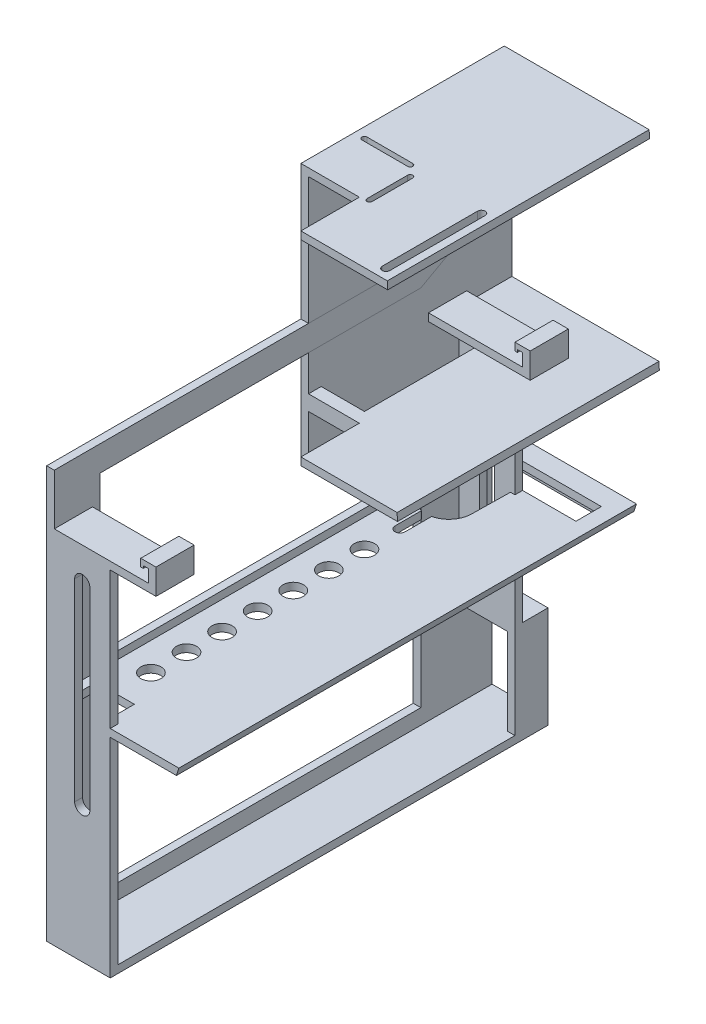
from build123d import *

# Parameters (mm, degrees)
EXTRUDE_1_DEPTH           = 103
EXTRUDE_2_DEPTH           = 180
SKETCH_4_W                = 23
SKETCH_4_H                = 23
CUT_EXTRUDE_5_DEPTH       = 80
SKETCH_1_4_W              = 24.5
SKETCH_1_4_H              = 20
SKETCH_1_4_W_2            = 18.5
SKETCH_1_4_H_2            = 14
EXTRUDE_3_DEPTH           = 80
SKETCH_5_W                = 17
SKETCH_5_H                = 60
CUT_EXTRUDE_6_DEPTH       = 23
CUT_EXTRUDE_7_DEPTH       = 23
CUT_EXTRUDE_8_DEPTH       = 23
SKETCH_8_W                = 25
SKETCH_8_H                = 85
EXTRUDE_4_DEPTH           = 5
SKETCH_9_W                = 0.952941176
SKETCH_9_H                = 3
CUT_EXTRUDE_9_DEPTH       = 200
EXTRUDE_5_DEPTH           = 7
CUT_EXTRUDE_12_DEPTH      = 234.122285507
CUT_EXTRUDE_12_DEPTH_BACK = 25
SKETCH_13_W               = 7.8
SKETCH_13_H               = 3
CUT_EXTRUDE_14_DEPTH      = 234.122285507
CUT_EXTRUDE_14_DEPTH_BACK = 3
SKETCH_13_5_W             = 7.8
SKETCH_13_5_H             = 79
SKETCH_15_W               = 25
SKETCH_15_H               = 40
SKETCH_15_W_2             = 19
SKETCH_15_H_2             = 34
EXTRUDE_6_DEPTH           = 10
SKETCH_16_W               = 22
SKETCH_16_H               = 100
EXTRUDE_7_DEPTH           = 3
SKETCH_20_W               = 43
SKETCH_20_H               = 10
CUT_EXTRUDE_15_DEPTH      = 3
SKETCH_24_W               = 3
SKETCH_24_H               = 52
EXTRUDE_8_DEPTH           = 3
SKETCH_25_W               = 25
SKETCH_25_H               = 137
EXTRUDE_9_DEPTH           = 3
SKETCH_28_W               = 15
SKETCH_28_H               = 10
CUT_EXTRUDE_16_DEPTH      = 3
SKETCH_29_W               = 1.908461085
SKETCH_29_H               = 79
CUT_EXTRUDE_17_DEPTH      = 22
CUT_EXTRUDE_18_DEPTH      = 10
CUT_EXTRUDE_19_DEPTH      = 10
SKETCH_30_W               = 15
SKETCH_30_H               = 10
CUT_EXTRUDE_20_DEPTH      = 10
SKETCH_31_W               = 3
SKETCH_31_H               = 34
EXTRUDE_10_DEPTH          = 3
SKETCH_32_W               = 156.2
SKETCH_32_H               = 52
EXTRUDE_11_DEPTH          = 3
EXTRUDE_14_DEPTH          = 5
SKETCH_36_W               = 3
SKETCH_36_H               = 162.2
EXTRUDE_15_DEPTH          = 20
SKETCH_37_W               = 29
SKETCH_37_H               = 162.2
EXTRUDE_16_DEPTH          = 3
SKETCH_37_3_W             = 3
SKETCH_37_3_H             = 162.2
EXTRUDE_17_DEPTH          = 3
CUT_EXTRUDE_START         = -3
CUT_EXTRUDE_23_OUTLINE_R  = 4
CUT_EXTRUDE_23_DEPTH      = 3
EXTRUDE_18_DEPTH          = 162.2
SKETCH_42_W               = 29
SKETCH_42_H               = 132.2
CUT_EXTRUDE_24_DEPTH      = 28
SKETCH_43_W               = 11
SKETCH_43_H               = 12
EXTRUDE_20_DEPTH          = 3
SKETCH_44_W               = 150.108461085
SKETCH_44_H               = 73
CUT_EXTRUDE_26_DEPTH      = 10
SKETCH_47_W               = 156.2
SKETCH_47_H               = 7
EXTRUDE_21_DEPTH          = 3
SKETCH_48_W               = 12
SKETCH_48_H               = 48
SKETCH_48_H_2             = 73
SKETCH_48_W_2             = 11.908461085
EXTRUDE_22_DEPTH          = 3
SKETCH_49_W               = 126.2
SKETCH_49_H               = 3
EXTRUDE_23_DEPTH          = 3


# Read off the part's stored shape, not the designer's step: 컷-돌출23
with BuildPart() as part:
    # 스케치1 → 보스-돌출1 (new body)
    with BuildSketch(Plane.XY):
        Polygon((0, 0), (61, 0), (60.85, 3), (3, 3), (3, 77), (57.15, 77), (57, 80), (0, 80), align=None)
    extrude(amount=EXTRUDE_1_DEPTH)

    # 스케치4 → 컷-돌출5 (cut)
    with BuildSketch(Plane(origin=(0, 80, 0), x_dir=(1, 0, 0), z_dir=(0, 1, 0))):
        with Locations((11.5, -91.5)):
            Rectangle(SKETCH_4_W, SKETCH_4_H)
    extrude(amount=-CUT_EXTRUDE_5_DEPTH, mode=Mode.SUBTRACT)

    # 스케치1<4> → 보스-돌출3 (add)
    with BuildSketch(Plane.XY):
        with Locations((12.25, -10)):
            Rectangle(SKETCH_1_4_W, SKETCH_1_4_H)
        with Locations((12.25, -10)):
            Rectangle(SKETCH_1_4_W_2, SKETCH_1_4_H_2, mode=Mode.SUBTRACT)
    extrude(amount=EXTRUDE_3_DEPTH)

    # 스케치5 → 컷-돌출6 (cut)
    with BuildSketch(Plane(origin=(0, 3, 0), x_dir=(1, 0, 0), z_dir=(0, 1, 0))):
        with Locations((11.5, -45)):
            Rectangle(SKETCH_5_W, SKETCH_5_H)
    extrude(amount=-CUT_EXTRUDE_6_DEPTH, mode=Mode.SUBTRACT)

    # 스케치6 → 컷-돌출7 (cut)
    with BuildSketch(Plane(origin=(0, 80, 0), x_dir=(1, 0, 0), z_dir=(0, 1, 0))):
        with BuildLine():
            Line((27, -63), (27, -79))
            ThreePointArc((27, -79), (26, -80), (25, -79))
            Line((25, -79), (25, -63))
            ThreePointArc((25, -63), (26, -62), (27, -63))
        make_face()
        with BuildLine():
            Line((22, -60), (4, -60))
            ThreePointArc((4, -60), (3, -59), (4, -58))
            Line((4, -58), (22, -58))
            ThreePointArc((22, -58), (23, -59), (22, -60))
        make_face()
    extrude(amount=-CUT_EXTRUDE_7_DEPTH, mode=Mode.SUBTRACT)

    # 스케치7 → 컷-돌출8 (cut)
    with BuildSketch(Plane(origin=(0, 80, 0), x_dir=(1, 0, 0), z_dir=(0, 1, 0))):
        with BuildLine():
            Line((54, -61.5), (54, -99))
            ThreePointArc((54, -99), (52.5, -100.5), (51, -99))
            Line((51, -99), (51, -61.5))
            ThreePointArc((51, -61.5), (52.5, -60), (54, -61.5))
        make_face()
    extrude(amount=-CUT_EXTRUDE_8_DEPTH, mode=Mode.SUBTRACT)


with BuildPart() as body_2:
    # 스케치1<3> → 보스-돌출2 (new body)
    with BuildSketch(Plane.XY):
        Polygon((0, -50), (52, -50), (51.047058824, -53), (3, -53), (3, -132), (25.952941176, -132), (25, -135), (0, -135), align=None)
    extrude(amount=EXTRUDE_2_DEPTH)

    # 스케치8 → 보스-돌출4 (add)
    with BuildSketch(Plane.XY.offset(180)):
        with Locations((12.5, -92.5)):
            Rectangle(SKETCH_8_W, SKETCH_8_H)
    extrude(amount=-EXTRUDE_4_DEPTH)

    # 스케치9 → 컷-돌출9 (cut)
    with BuildSketch(Plane.XY.offset(180)):
        with Locations((25.476470588, -133.5)):
            Rectangle(SKETCH_9_W, SKETCH_9_H)
    extrude(amount=-CUT_EXTRUDE_9_DEPTH, mode=Mode.SUBTRACT)

    # 스케치12 → 보스-돌출5 (add)
    with BuildSketch(Plane(origin=(0, -50, 0), x_dir=(1, 0, 0), z_dir=(0, 1, 0))):
        with BuildLine():
            Line((8, -2), (45.5, -2))
            ThreePointArc((45.5, -2), (46.8, -3.3), (45.5, -4.6))
            Line((45.5, -4.6), (8, -4.6))
            ThreePointArc((8, -4.6), (6.7, -3.3), (8, -2))
        make_face()
    extrude(amount=-EXTRUDE_5_DEPTH)

    # 스케치13 → 컷-돌출12 (cut, two sides: drawn at the far end of the back side and taken through both)
    with BuildSketch(Plane.ZY.offset(-CUT_EXTRUDE_12_DEPTH_BACK)):
        with Locations((3.9, -133.5)):
            Rectangle(SKETCH_13_W, SKETCH_13_H)
    extrude(amount=CUT_EXTRUDE_12_DEPTH + CUT_EXTRUDE_12_DEPTH_BACK, mode=Mode.SUBTRACT)

    # 스케치13<5> → 컷-돌출14 (cut, two sides: drawn at the far end of the back side and taken through both)
    with BuildSketch(Plane.ZY.offset(-CUT_EXTRUDE_14_DEPTH_BACK)):
        with Locations((3.9, -92.5)):
            Rectangle(SKETCH_13_5_W, SKETCH_13_5_H)
    extrude(amount=CUT_EXTRUDE_14_DEPTH + CUT_EXTRUDE_14_DEPTH_BACK, mode=Mode.SUBTRACT)

    # 스케치15 → 보스-돌출6 (add)
    with BuildSketch(Plane(origin=(0, 0, 7.8), x_dir=(-1, 0, 0), z_dir=(0, 0, -1))):
        with Locations((-12.5, -115)):
            Rectangle(SKETCH_15_W, SKETCH_15_H)
        with Locations((-12.5, -115)):
            Rectangle(SKETCH_15_W_2, SKETCH_15_H_2, mode=Mode.SUBTRACT)
    extrude(amount=-EXTRUDE_6_DEPTH)

    # 스케치16 → 보스-돌출7 (add)
    with BuildSketch(Plane.XY.offset(17.8)):
        with Locations((14, -48)):
            Rectangle(SKETCH_16_W, SKETCH_16_H)
    extrude(amount=EXTRUDE_7_DEPTH)

    # 스케치20 → 컷-돌출15 (cut)
    with BuildSketch(Plane(origin=(0, -50, 0), x_dir=(1, 0, 0), z_dir=(0, 1, 0))):
        with Locations((24.5, -12.8)):
            Rectangle(SKETCH_20_W, SKETCH_20_H)
    extrude(amount=-CUT_EXTRUDE_15_DEPTH, mode=Mode.SUBTRACT)

    # 스케치24 → 보스-돌출8 (add)
    with BuildSketch(Plane.ZY.offset(-3)):
        with Locations((19.3, -24)):
            Rectangle(SKETCH_24_W, SKETCH_24_H)
    extrude(amount=EXTRUDE_8_DEPTH)

    # 스케치25 → 보스-돌출9 (add)
    with BuildSketch(Plane.XY.offset(180)):
        with Locations((12.5, -66.5)):
            Rectangle(SKETCH_25_W, SKETCH_25_H)
    extrude(amount=-EXTRUDE_9_DEPTH)

    # 스케치28 → 컷-돌출16 (cut)
    with BuildSketch(Plane(origin=(0, -50, 0), x_dir=(1, 0, 0), z_dir=(0, 1, 0))):
        with Locations((14, -172)):
            Rectangle(SKETCH_28_W, SKETCH_28_H)
    extrude(amount=-CUT_EXTRUDE_16_DEPTH, mode=Mode.SUBTRACT)

    # 스케치29 → 컷-돌출17 (cut)
    with BuildSketch(Plane(origin=(25, 0, 0), x_dir=(0, 0, -1), z_dir=(1, 0, 0))):
        with Locations((-175.954230542, -92.5)):
            Rectangle(SKETCH_29_W, SKETCH_29_H)
    extrude(amount=-CUT_EXTRUDE_17_DEPTH, mode=Mode.SUBTRACT)

    # 스케치26 → 컷-돌출18 (cut)
    with BuildSketch(Plane.XY.offset(180)):
        with BuildLine():
            Line((17, -6), (17, -82))
            ThreePointArc((17, -82), (14, -85), (11, -82))
            Line((11, -82), (11, -6))
            ThreePointArc((11, -6), (14, -3), (17, -6))
        make_face()
    extrude(amount=-CUT_EXTRUDE_18_DEPTH, mode=Mode.SUBTRACT)

    # 스케치21 → 컷-돌출19 (cut)
    with BuildSketch(Plane(origin=(0, 0, 17.8), x_dir=(-1, 0, 0), z_dir=(0, 0, -1))):
        with BuildLine():
            Line((-17, -82), (-17, -6))
            ThreePointArc((-17, -6), (-14, -3), (-11, -6))
            Line((-11, -6), (-11, -82))
            ThreePointArc((-11, -82), (-14, -85), (-17, -82))
        make_face()
    extrude(amount=-CUT_EXTRUDE_19_DEPTH, mode=Mode.SUBTRACT)

    # 스케치30 → 컷-돌출20 (cut)
    with BuildSketch(Plane(origin=(0, -50, 0), x_dir=(1, 0, 0), z_dir=(0, 1, 0))):
        with Locations((14, -25.8)):
            Rectangle(SKETCH_30_W, SKETCH_30_H)
    extrude(amount=-CUT_EXTRUDE_20_DEPTH, mode=Mode.SUBTRACT)

    # 스케치31 → 보스-돌출10 (add)
    with BuildSketch(Plane(origin=(25, 0, 0), x_dir=(0, 0, -1), z_dir=(1, 0, 0))):
        with Locations((-19.3, -115)):
            Rectangle(SKETCH_31_W, SKETCH_31_H)
    extrude(amount=-EXTRUDE_10_DEPTH)

    # 스케치32 → 보스-돌출11 (add)
    with BuildSketch(Plane(origin=(3, 0, 0), x_dir=(0, 0, -1), z_dir=(1, 0, 0))):
        with Locations((-98.9, -24)):
            Rectangle(SKETCH_32_W, SKETCH_32_H)
    extrude(amount=-EXTRUDE_11_DEPTH)

    # 스케치35 → 보스-돌출14 (add)
    with BuildSketch(Plane(origin=(0, 2, 0), x_dir=(1, 0, 0), z_dir=(0, 1, 0))):
        Polygon((25, -20.8), (25, -17.8), (0, -17.8), (0, -180), (25, -180), (25, -177), (3, -177), (3, -20.8), align=None)
    extrude(amount=EXTRUDE_14_DEPTH)

    # 스케치36 → 보스-돌출15 (add)
    with BuildSketch(Plane(origin=(0, 7, 0), x_dir=(1, 0, 0), z_dir=(0, 1, 0))):
        with Locations((1.5, -98.9)):
            Rectangle(SKETCH_36_W, SKETCH_36_H)
    extrude(amount=EXTRUDE_15_DEPTH)

    # 스케치37 → 보스-돌출16 (add)
    with BuildSketch(Plane(origin=(0, 7, 0), x_dir=(1, 0, 0), z_dir=(0, 1, 0))):
        with Locations((28.5, -98.9)):
            Rectangle(SKETCH_37_W, SKETCH_37_H)
    extrude(amount=-EXTRUDE_16_DEPTH)

    # 스케치37<3> → 보스-돌출17 (add)
    with BuildSketch(Plane(origin=(0, 7, 0), x_dir=(1, 0, 0), z_dir=(0, 1, 0))):
        with Locations((41.5, -98.9)):
            Rectangle(SKETCH_37_3_W, SKETCH_37_3_H)
    extrude(amount=EXTRUDE_17_DEPTH)

    # 컷-돌출23 outline → 컷-돌출23 (cut)
    with BuildSketch(Plane(origin=(0, -50, 0), x_dir=(1, 0, 0), z_dir=(0, 1, 0)).offset(CUT_EXTRUDE_START)):
        with BuildLine():
            Line((4.75, -20.8), (5, -35.774937186))
            ThreePointArc((5, -35.774937186), (6.968337898, -41.392385725), (12.01238402, -44.552714963))
            ThreePointArc((12.01238402, -44.552714963), (12.003098405, -44.663653674), (12, -44.774937186))
            Line((12, -44.774937186), (12, -55))
            ThreePointArc((12, -55), (14, -57), (16, -55))
            Line((16, -55), (16, -44.774937186))
            ThreePointArc((16, -44.774937186), (15.996901595, -44.663653674), (15.98761598, -44.552714963))
            ThreePointArc((15.98761598, -44.552714963), (21.031662102, -41.392385725), (23, -35.774937186))
            Line((23, -35.774937186), (23.25, -20.8))
            Line((23.25, -20.8), (21.5, -20.8))
            Line((21.5, -20.8), (21.5, -30.8))
            Line((21.5, -30.8), (6.5, -30.8))
            Line((6.5, -30.8), (6.5, -20.8))
            Line((6.5, -20.8), (4.75, -20.8))
        make_face()
        with Locations((14, -69)):
            Circle(CUT_EXTRUDE_23_OUTLINE_R)
        with Locations((14, -153)):
            Circle(CUT_EXTRUDE_23_OUTLINE_R)
        with Locations((14, -139)):
            Circle(CUT_EXTRUDE_23_OUTLINE_R)
        with Locations((14, -125)):
            Circle(CUT_EXTRUDE_23_OUTLINE_R)
        with Locations((14, -111)):
            Circle(CUT_EXTRUDE_23_OUTLINE_R)
        with Locations((14, -97)):
            Circle(CUT_EXTRUDE_23_OUTLINE_R)
        with Locations((14, -83)):
            Circle(CUT_EXTRUDE_23_OUTLINE_R)
    extrude(amount=CUT_EXTRUDE_23_DEPTH, mode=Mode.SUBTRACT)

    # 스케치41 → 보스-돌출18 (add)
    with BuildSketch(Plane(origin=(0, 0, 17.8), x_dir=(-1, 0, 0), z_dir=(0, 0, -1))):
        Polygon((-40, 10), (-40, 12), (-38, 12), (-38, 11), (-37, 11), (-37, 14), (-43, 14), (-43, 10), align=None)
    extrude(amount=-EXTRUDE_18_DEPTH)

    # 스케치42 → 컷-돌출24 (cut)
    with BuildSketch(Plane(origin=(0, 27, 0), x_dir=(1, 0, 0), z_dir=(0, 1, 0))):
        with Locations((28.5, -98.9)):
            Rectangle(SKETCH_42_W, SKETCH_42_H)
    extrude(amount=-CUT_EXTRUDE_24_DEPTH, mode=Mode.SUBTRACT)

    # 스케치43 → 보스-돌출20 (add)
    with BuildSketch(Plane(origin=(0, 7, 0), x_dir=(1, 0, 0), z_dir=(0, 1, 0))):
        with Locations((8.5, -171)):
            Rectangle(SKETCH_43_W, SKETCH_43_H)
        with Locations((8.5, -26.8)):
            Rectangle(SKETCH_43_W, SKETCH_43_H)
    extrude(amount=-EXTRUDE_20_DEPTH)

    # 스케치44 → 컷-돌출26 (cut)
    with BuildSketch(Plane(origin=(3, 0, 0), x_dir=(0, 0, -1), z_dir=(1, 0, 0))):
        with Locations((-98.854230543, -92.5)):
            Rectangle(SKETCH_44_W, SKETCH_44_H)
        Polygon((-177, 24), (-20.8, 24), (-20.8, 17), (-35.8, 17), (-35.8, 1), (-23.8, 1), (-23.8, -47), (-174, -47), (-174, 1), (-162, 1), (-162, 17), (-177, 17), align=None)
    extrude(amount=-CUT_EXTRUDE_26_DEPTH, mode=Mode.SUBTRACT)

    # 스케치47 → 보스-돌출21 (add)
    with BuildSketch(Plane(origin=(3, 0, 0), x_dir=(0, 0, -1), z_dir=(1, 0, 0))):
        with Locations((-98.9, 20.5)):
            Rectangle(SKETCH_47_W, SKETCH_47_H)
    extrude(amount=-EXTRUDE_21_DEPTH)

    # 스케치48 → 보스-돌출22 (add)
    with BuildSketch(Plane.ZY):
        with Locations((29.8, -23)):
            Rectangle(SKETCH_48_W, SKETCH_48_H)
        with Locations((168, -23)):
            Rectangle(SKETCH_48_W, SKETCH_48_H)
        with Locations((29.8, -92.5)):
            Rectangle(SKETCH_48_W, SKETCH_48_H_2)
        with Locations((167.954230542, -92.5)):
            Rectangle(SKETCH_48_W_2, SKETCH_48_H_2)
    extrude(amount=-EXTRUDE_22_DEPTH)

    # 스케치49 → 보스-돌출23 (add)
    with BuildSketch(Plane(origin=(3, 0, 0), x_dir=(0, 0, -1), z_dir=(1, 0, 0))):
        with Locations((-98.9, -127.5)):
            Rectangle(SKETCH_49_W, SKETCH_49_H)
    extrude(amount=-EXTRUDE_23_DEPTH)


solid = Compound([part.part, body_2.part])
